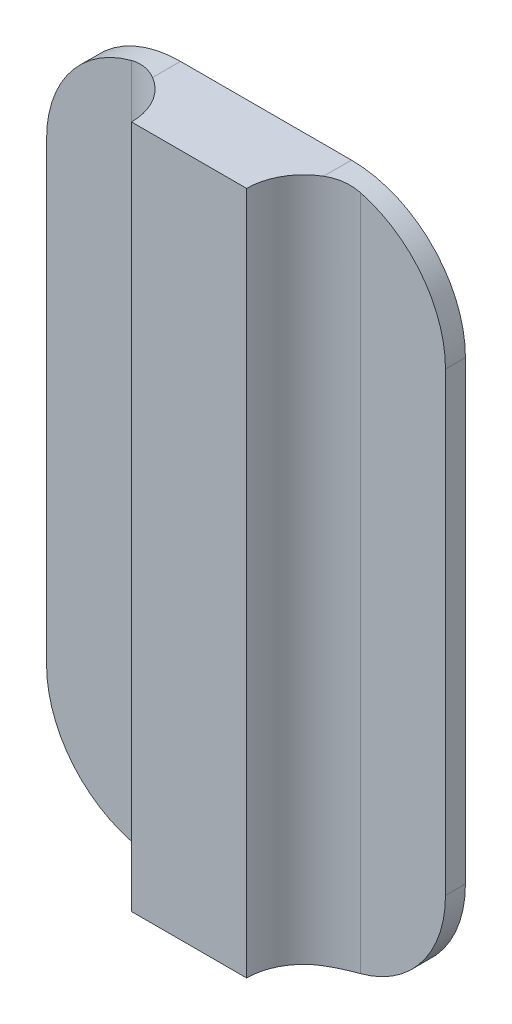
from build123d import *

# Parameters (mm, degrees)
SKETCH_1_W      = 70
SKETCH_1_H      = 120
EXTRUDE_1_DEPTH = 3.5
SKETCH_2_W      = 20.2
SKETCH_2_H      = 120
EXTRUDE_2_DEPTH = 10
FILLET_1_R      = 10
FILLET_2_R      = 20


with BuildPart() as part:
    # ｽｹｯﾁ1 → ﾎﾞｽ - 押し出し1 (new body)
    with BuildSketch(Plane.XY):
        with Locations((35, 60)):
            Rectangle(SKETCH_1_W, SKETCH_1_H)
    extrude(amount=EXTRUDE_1_DEPTH)

    # ｽｹｯﾁ2 → ﾎﾞｽ - 押し出し2 (add)
    with BuildSketch(Plane.XY.offset(3.5)):
        with Locations((35, 60)):
            Rectangle(SKETCH_2_W, SKETCH_2_H)
    extrude(amount=EXTRUDE_2_DEPTH)

    # ﾌｨﾚｯﾄ1
    fillet_1_edges = [part.edges().sort_by_distance(p)[0] for p in [
        (24.9, 60, 3.5),
        (45.1, 60, 3.5),
    ]]
    fillet(fillet_1_edges, radius=FILLET_1_R - 0.0001)  # a hair under: the kernel refuses the full size

    # ﾌｨﾚｯﾄ2
    fillet_2_edges = [part.edges().sort_by_distance(p)[0] for p in [
        (70, 120, 1.75),
        (70, 0, 1.75),
        (0, 0, 1.75),
        (0, 120, 1.75),
    ]]
    fillet(fillet_2_edges, radius=FILLET_2_R)


solid = part.part
